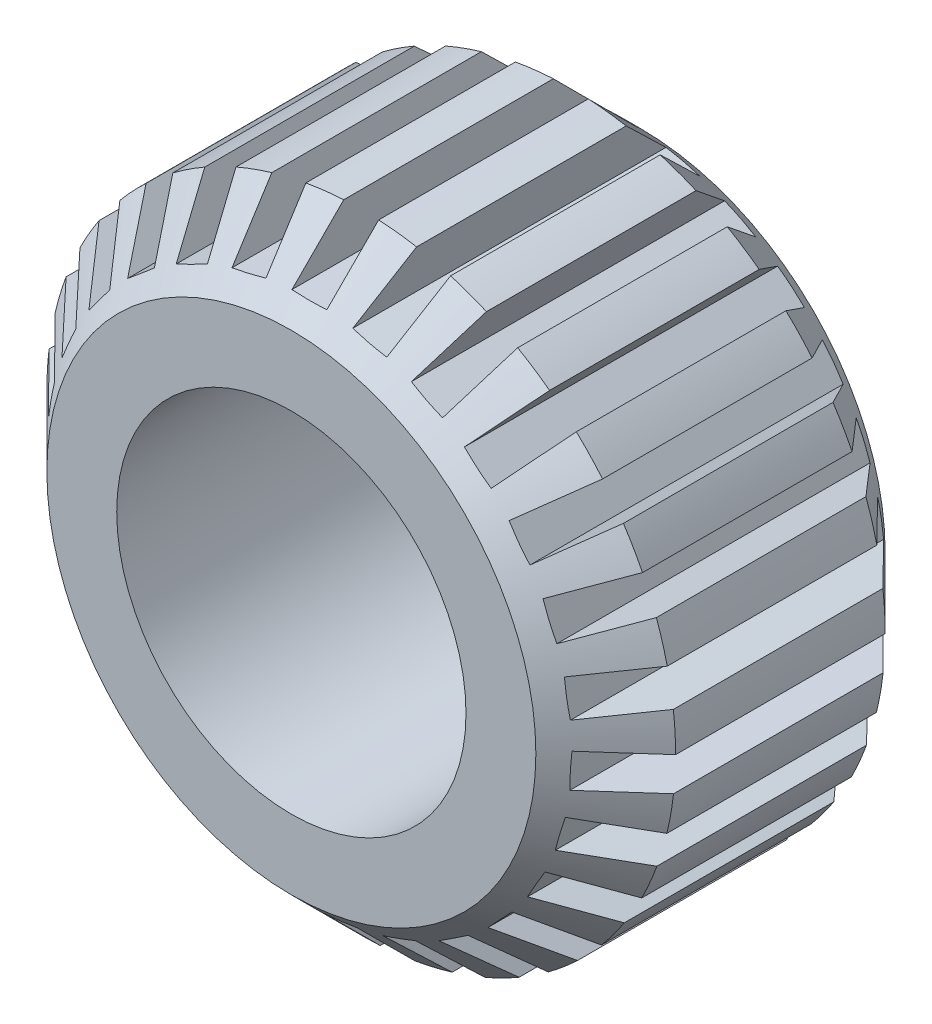
from build123d import *

# Parameters (mm, degrees)
SKETCH1_R           = 9
SKETCH1_R_2         = 5
BOSS_EXTRUDE1_DEPTH = 10
CHAMFER1_SIZE       = 2
CUT_EXTRUDE1_DEPTH  = 17.186414056
CIRPATTERN1_COUNT   = 27


with BuildPart() as part:
    # Sketch1 → Boss-Extrude1 (new body)
    with BuildSketch(Plane.XY):
        Circle(SKETCH1_R)
        Circle(SKETCH1_R_2, mode=Mode.SUBTRACT)
    extrude(amount=-BOSS_EXTRUDE1_DEPTH)

    # Chamfer1
    chamfer1_edges = [part.edges().sort_by_distance(p)[0] for p in [
        (-9, 0, -10),
        (-9, 0, 0),
    ]]
    chamfer(chamfer1_edges, length=CHAMFER1_SIZE)

    # Sketch2 → Cut-Extrude1 (cut, through all)
    with BuildSketch(Plane.XY):
        with BuildLine():
            Line((-0.5, 7.5), (0.5, 7.5))
            Line((0.5, 7.5), (0.5, 8.986100378))
            ThreePointArc((0.5, 8.986100378), (0, 9), (-0.5, 8.986100378))
            Line((-0.5, 8.986100378), (-0.5, 7.5))
        make_face()
    cut_extrude1 = extrude(amount=-CUT_EXTRUDE1_DEPTH, mode=Mode.SUBTRACT)

    # CirPattern1: Cut-Extrude1 ×27 about axis
    cirpattern1_axis = Axis((0, 0, 0), (0, 0, 1))
    for i in range(1, CIRPATTERN1_COUNT):
        add(cut_extrude1.rotate(cirpattern1_axis, i * 360 / CIRPATTERN1_COUNT), mode=Mode.SUBTRACT)


solid = part.part
